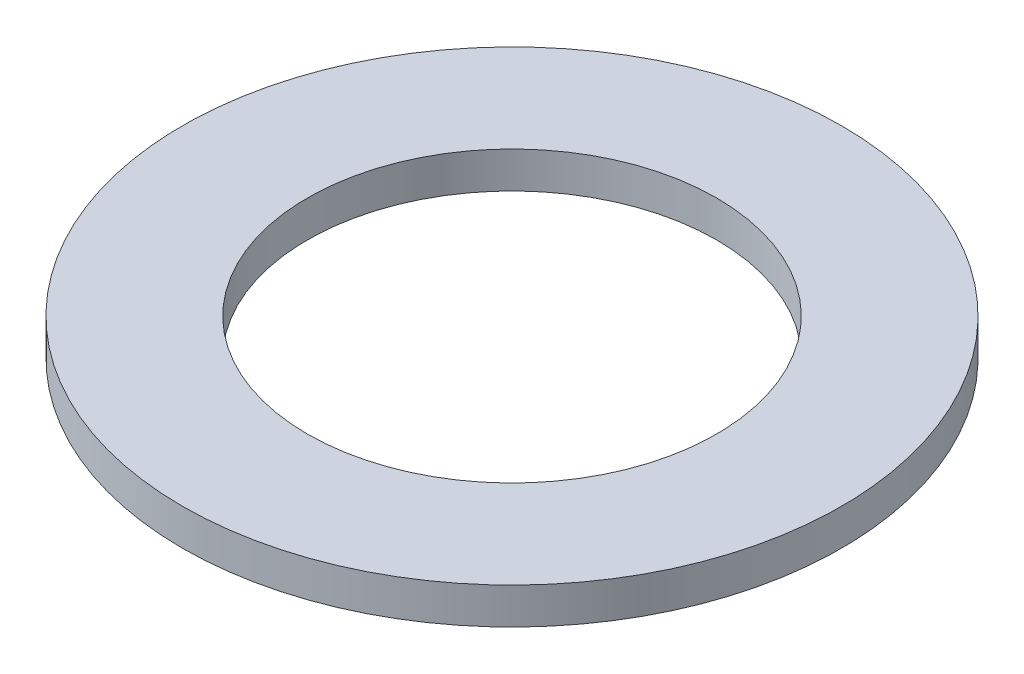
from build123d import *

# Parameters (mm, degrees)
SKETCH1_R           = 72.5
BOSS_EXTRUDE1_DEPTH = 8
SKETCH2_R           = 45
CUT_EXTRUDE1_DEPTH  = 103.842111997


with BuildPart() as part:
    # Sketch1 → Boss-Extrude1 (new body)
    with BuildSketch(Plane(origin=(0, 0, 0), x_dir=(1, 0, 0), z_dir=(0, 1, 0))):
        Circle(SKETCH1_R)
    extrude(amount=BOSS_EXTRUDE1_DEPTH)

    # Sketch2 → Cut-Extrude1 (cut, through all)
    with BuildSketch(Plane(origin=(0, 0, 0), x_dir=(1, 0, 0), z_dir=(0, 1, 0))):
        Circle(SKETCH2_R)
    extrude(amount=CUT_EXTRUDE1_DEPTH, mode=Mode.SUBTRACT)


solid = part.part
